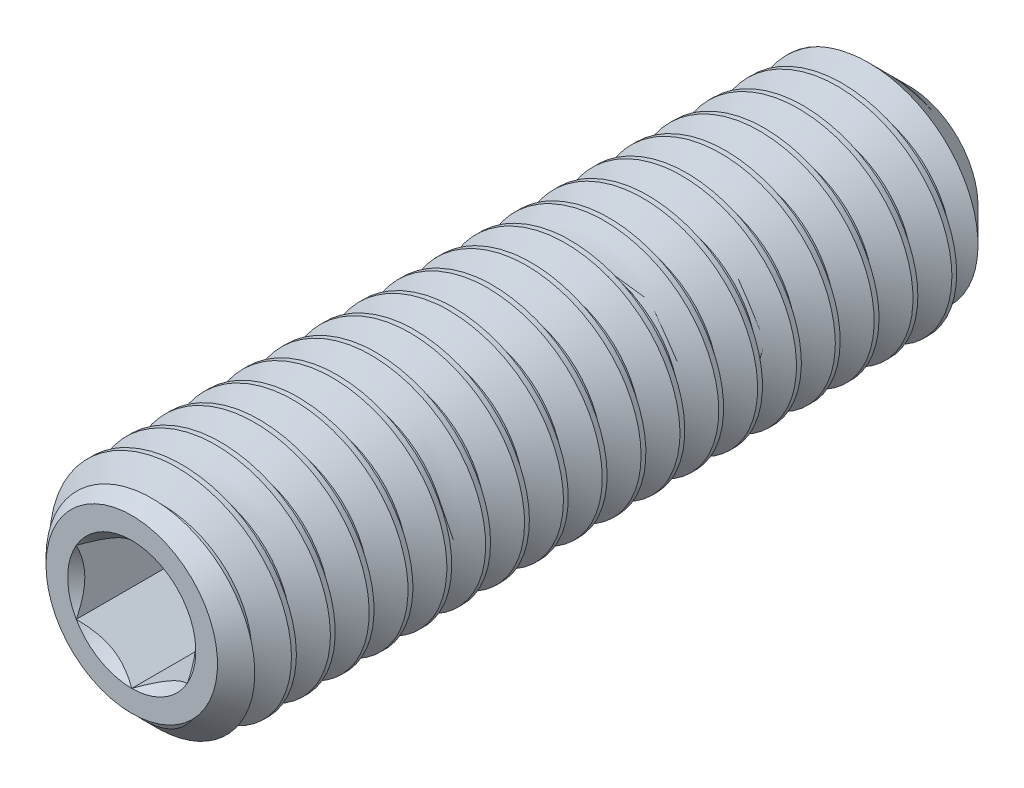
from build123d import *

# Parameters (mm, degrees)
CUT_EXTRUDE1_DEPTH = 7
CUT_SWEEP1_PITCH   = 0.7


with BuildPart() as part:
    # Sketch2 → Revolve1 (revolve)
    with BuildSketch(Plane(origin=(0, 0, 0), x_dir=(0, 0, -1), z_dir=(1, 0, 0)), mode=Mode.PRIVATE) as revolve1_sk:
        Polygon((-7, 0), (7, 0), (7, 1.25), (6.25, 2), (-6.545336663, 2), (-7, 1.545336663), align=None)
    revolve(revolve1_sk.sketch.rotate(Axis((0, 0, 7), (0, 0, -1)), 180), axis=Axis((0, 0, 7), (0, 0, -1)))

    # Sketch3 → Cut-Extrude1 (cut)
    with BuildSketch(Plane.XY.offset(7)):
        Polygon((0, 1.154700538), (-1, 0.577350269), (-1, -0.577350269), (0, -1.154700538), (1, -0.577350269), (1, 0.577350269), align=None)
    extrude(amount=-CUT_EXTRUDE1_DEPTH, mode=Mode.SUBTRACT)

    # Cut-Extrude2 cone 1 section (through the dimple's axis) → Cut-Extrude2 (revolve, cut)
    with BuildSketch(Plane(origin=(0, 0, 0), x_dir=(0, -1, 0), z_dir=(1, 0, 0))):
        Polygon((0, 0), (1, 0), (0, 0.577350269), align=None)
    revolve(axis=Axis((0, 0, 0), (0, 0, -1)), mode=Mode.SUBTRACT)

    # Cut-Extrude3 cone 1 section (through the dimple's axis) → Cut-Extrude3 (revolve, cut)
    with BuildSketch(Plane(origin=(0, 0, 7), x_dir=(0, -1, 0), z_dir=(1, 0, 0))):
        Polygon((0, 0), (1.154700538, 0), (0, 1.154700538), align=None)
    revolve(axis=Axis((0, 0, 7), (0, 0, -1)), mode=Mode.SUBTRACT)

    # Cut-Sweep1: the profile of Sketch7 screwed along a right-hand helix of 21 turns, 6 arcs to a turn; built about Z, then put on its axis
    cut_sweep1_z = Axis((0, 0, 0), (0, 0, 1))
    cut_sweep1_corners = [(2.037888611, 0, -0.634375), (2.037888611, 0, 0.021875), (1.545336663, 0, -0.2625), (1.545336663, 0, -0.35)]
    with BuildLine(mode=Mode.PRIVATE) as cut_sweep1_profile:
        Line(cut_sweep1_corners[0], cut_sweep1_corners[1])
        Line(cut_sweep1_corners[1], cut_sweep1_corners[2])
        Line(cut_sweep1_corners[2], cut_sweep1_corners[3])
        Line(cut_sweep1_corners[3], cut_sweep1_corners[0])
    cut_sweep1_cap = Face(cut_sweep1_profile.wire())
    cut_sweep1_turn_angles = [0, 30, 60, 90, 120, 150, 180, 210, 240, 270, 300, 330, 360]
    cut_sweep1_turn_weights = [1, 0.8660254037844387, 1, 0.8660254037844387, 1, 0.8660254037844387, 1, 0.8660254037844387, 1, 0.8660254037844387, 1, 0.8660254037844387, 1]
    cut_sweep1_turn_rails = [Edge.make_bspline([Vector(p[0], p[1], 0).rotate(cut_sweep1_z, cut_sweep1_turn_angles[k]) / cut_sweep1_turn_weights[k] + Vector(0, 0, p[2] + CUT_SWEEP1_PITCH * cut_sweep1_turn_angles[k] / 360) for k in range(13)], [0, 0, 0, 1, 1, 2, 2, 3, 3, 4, 4, 5, 5, 6, 6, 6], 2, cut_sweep1_turn_weights) for p in cut_sweep1_corners]
    cut_sweep1_turn_sides = [Face.make_surface_from_curves(cut_sweep1_turn_rails[p[0]], cut_sweep1_turn_rails[p[1]]) for p in [(0, 1), (1, 2), (2, 3), (3, 0)]]
    cut_sweep1 = Plane(origin=(0, 0, 7), x_dir=(0, 1, 0), z_dir=(0, 0, -1)) * Solid(Shell([*[p.moved(Location((0, 0, CUT_SWEEP1_PITCH * i))) for i in range(21) for p in cut_sweep1_turn_sides], cut_sweep1_cap, cut_sweep1_cap.rotate(cut_sweep1_z, 7560).moved(Location((0, 0, CUT_SWEEP1_PITCH * 7560 / 360)))]))
    add(cut_sweep1, mode=Mode.SUBTRACT)


solid = part.part
